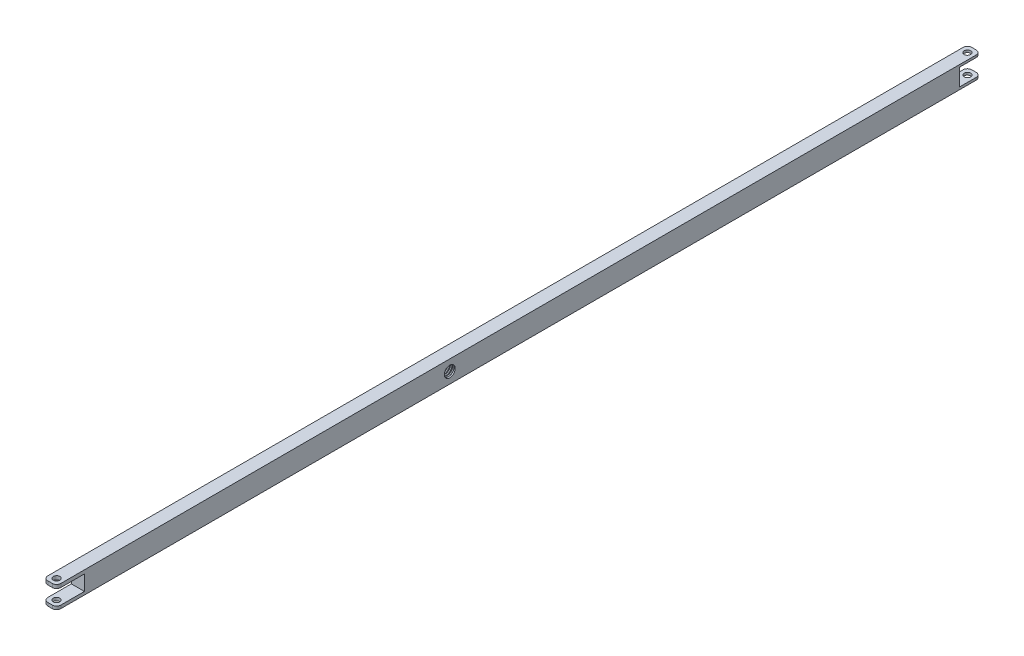
from build123d import *

# Parameters (mm, degrees)
BOSS_EXTRUDE1_DEPTH = 457.2
SKETCH3_R           = 3.174999999999999
CUT_EXTRUDE2_DEPTH  = 15
SKETCH4_W           = 16.186958622870407
SKETCH4_H           = 8.820479470088856
CUT_EXTRUDE3_DEPTH  = 15
CUT_EXTRUDE4_DEPTH  = 15
FILLET1_R           = 2.5
BOSS_EXTRUDE2_DEPTH = 80
SKETCH7_W           = 12.133098250404359
SKETCH7_H           = 9.93818971212817
CUT_EXTRUDE5_DEPTH  = 80
CUT_EXTRUDE6_DEPTH  = 80
FILLET2_R           = 2.5
THREAD1_PITCH       = 1.27


with BuildPart() as part:
    # Sketch1 → Boss-Extrude1 (new body)
    with BuildSketch(Plane.XY):
        Polygon((0, 0), (7.619999999999999, 0), (7.6199999999999966, 12.7), (-2.33e-15, 12.7), align=None)
    extrude(amount=BOSS_EXTRUDE1_DEPTH)

    # Sketch3 → Cut-Extrude2 (cut)
    with BuildSketch(Plane(origin=(7.619999999999999, 1.56e-15, 0), x_dir=(0, 0, -1), z_dir=(1, 2e-16, 0))):
        with Locations(Location((-228.6, 6.349999999999998, 0), (0, 0, 90))):
            Circle(SKETCH3_R)
    extrude(amount=-CUT_EXTRUDE2_DEPTH, mode=Mode.SUBTRACT)

    # Sketch4 → Cut-Extrude3 (cut)
    with BuildSketch(Plane(origin=(7.619999999999999, 1.56e-15, 0), x_dir=(0, 0, -1), z_dir=(1, 2e-16, 0))):
        with Locations((-449.10652068856473, 6.226228187441453)):
            Rectangle(SKETCH4_W, SKETCH4_H)
    extrude(amount=-CUT_EXTRUDE3_DEPTH, mode=Mode.SUBTRACT)

    # Sketch5 → Cut-Extrude4 (cut)
    with BuildSketch(Plane(origin=(0, 12.7, 0), x_dir=(1, 0, 0), z_dir=(0, 1, 0))):
        with BuildLine():
            ThreePointArc((5.157644125371133, -452.0423558746288), (2.4623558746288174, -452.04235587462887), (2.462355874628769, -454.73764412537116))
            Line((2.4623558746288032, -454.73764412537116), (5.157644125371156, -452.0423558746288))
        make_face()
        with BuildLine():
            Line((5.157644125371156, -452.0423558746288), (2.4623558746288032, -454.73764412537116))
            ThreePointArc((2.462355874628769, -454.73764412537116), (4.539339745035781, -455.15078190404324), (5.715856599352348, -453.39000000000004))
            ThreePointArc((5.715856599352348, -453.39000000000004), (5.570781904043185, -452.66066025496417), (5.157644125371133, -452.0423558746288))
        make_face()
    extrude(amount=-CUT_EXTRUDE4_DEPTH, mode=Mode.SUBTRACT)

    # Fillet1
    fillet1_edges = [part.edges().sort_by_distance(p)[0] for p in [
        (7.619999999999999, 0.9079942261985133, 457.2),
        (-1.7e-16, 0.9079942261985128, 457.2),
        (7.6199999999999966, 11.66823396124294, 457.2),
        (-2.14e-15, 11.66823396124294, 457.2),
    ]]
    fillet(fillet1_edges, radius=FILLET1_R)

    # Sketch6 → Boss-Extrude2 (add)
    with BuildSketch(Plane(origin=(0, 0, 0), x_dir=(-1, 0, 0), z_dir=(0, 0, -1))):
        Polygon((0, 0), (2.33e-15, 12.7), (-7.6199999999999966, 12.7), (-7.619999999999999, 0), align=None)
    extrude(amount=BOSS_EXTRUDE2_DEPTH)

    # Sketch7 → Cut-Extrude5 (cut)
    with BuildSketch(Plane(origin=(7.619999999999999, 1.56e-15, 0), x_dir=(0, 0, -1), z_dir=(1, 2e-16, 0))):
        with Locations((73.93345087479781, 6.395782886205599)):
            Rectangle(SKETCH7_W, SKETCH7_H)
    extrude(amount=-CUT_EXTRUDE5_DEPTH, mode=Mode.SUBTRACT)

    # Sketch8 → Cut-Extrude6 (cut)
    with BuildSketch(Plane(origin=(0, 12.7, 0), x_dir=(1, 0, 0), z_dir=(0, 1, 0))):
        with BuildLine():
            ThreePointArc((5.796561175478846, 76.10843882452126), (4.620573114134323, 77.86842933395528), (2.5445227573184317, 77.45547724268162))
            Line((2.544522757318436, 77.45547724268162), (5.238599593639238, 74.76140040636089))
            ThreePointArc((5.238599593639247, 74.7614004063609), (5.651551684912855, 75.37942688586578), (5.796561175478846, 76.10843882452126))
        make_face()
        with BuildLine():
            Line((5.238599593639238, 74.76140040636089), (2.544522757318436, 77.45547724268162))
            ThreePointArc((2.5445227573184317, 77.45547724268162), (2.5445227573184717, 74.76140040636085), (5.238599593639247, 74.7614004063609))
        make_face()
    extrude(amount=-CUT_EXTRUDE6_DEPTH, mode=Mode.SUBTRACT)

    # Fillet2
    fillet2_edges = [part.edges().sort_by_distance(p)[0] for p in [
        (-1.3e-16, 0.7133440150707573, -80),
        (7.6199999999999966, 12.032438871134843, -80),
        (-2.21e-15, 12.032438871134842, -80),
        (7.619999999999999, 0.7133440150707582, -80),
    ]]
    fillet(fillet2_edges, radius=FILLET2_R)

    # Thread1: the profile of Thread Profile1 profile screwed along a right-hand helix of 7.874016 turns, 8 arcs to a turn; built about Z, then put on its axis
    thread1_z = Axis((0, 0, 0), (0, 0, 1))
    thread1_corners = [(3.1747, 0, -0.000173205), (3.862407661, 0, 0.396874998), (3.862407661, 0, 0.555624998), (3.1747, 0, 0.952673202)]
    with BuildLine(mode=Mode.PRIVATE) as thread1_profile:
        Line(thread1_corners[0], thread1_corners[1])
        Line(thread1_corners[1], thread1_corners[2])
        Line(thread1_corners[2], thread1_corners[3])
        Line(thread1_corners[3], thread1_corners[0])
    thread1_cap = Face(thread1_profile.wire())
    thread1_turn_angles = [0, 22.5, 45, 67.5, 90, 112.5, 135, 157.5, 180, 202.5, 225, 247.5, 270, 292.5, 315, 337.5, 360]
    thread1_turn_weights = [1, 0.9238795325112867, 1, 0.9238795325112867, 1, 0.9238795325112867, 1, 0.9238795325112867, 1, 0.9238795325112867, 1, 0.9238795325112867, 1, 0.9238795325112867, 1, 0.9238795325112867, 1]
    thread1_turn_rails = [Edge.make_bspline([Vector(p[0], p[1], 0).rotate(thread1_z, thread1_turn_angles[k]) / thread1_turn_weights[k] + Vector(0, 0, p[2] + THREAD1_PITCH * thread1_turn_angles[k] / 360) for k in range(17)], [0, 0, 0, 1, 1, 2, 2, 3, 3, 4, 4, 5, 5, 6, 6, 7, 7, 8, 8, 8], 2, thread1_turn_weights) for p in thread1_corners]
    thread1_turn_sides = [Face.make_surface_from_curves(thread1_turn_rails[p[0]], thread1_turn_rails[p[1]]) for p in [(0, 1), (1, 2), (2, 3), (3, 0)]]
    thread1_last_angles = [2520, 2542.5, 2565, 2587.5, 2610, 2632.5, 2655, 2677.5, 2700, 2722.5, 2745, 2767.5, 2790, 2812.322834646, 2834.645669291]
    thread1_last_weights = [1, 0.9238795325112867, 1, 0.9238795325112867, 1, 0.9238795325112867, 1, 0.9238795325112867, 1, 0.9238795325112867, 1, 0.9238795325112867, 1, 0.9250584165493104, 1]
    thread1_last_rails = [Edge.make_bspline([Vector(p[0], p[1], 0).rotate(thread1_z, thread1_last_angles[k]) / thread1_last_weights[k] + Vector(0, 0, p[2] + THREAD1_PITCH * thread1_last_angles[k] / 360) for k in range(15)], [0, 0, 0, 1, 1, 2, 2, 3, 3, 4, 4, 5, 5, 6, 6, 7, 7, 7], 2, thread1_last_weights) for p in thread1_corners]
    thread1_last_sides = [Face.make_surface_from_curves(thread1_last_rails[p[0]], thread1_last_rails[p[1]]) for p in [(0, 1), (1, 2), (2, 3), (3, 0)]]
    thread1 = Plane(origin=(7.62, 6.35, 228.6), x_dir=(0, 0, 1), z_dir=(-1, 0, 0)) * Solid(Shell([*[p.moved(Location((0, 0, THREAD1_PITCH * i))) for i in range(7) for p in thread1_turn_sides], *thread1_last_sides, thread1_cap, thread1_cap.rotate(thread1_z, 2834.645669291).moved(Location((0, 0, THREAD1_PITCH * 2834.645669291 / 360)))]))
    add(thread1, mode=Mode.SUBTRACT)


solid = part.part
